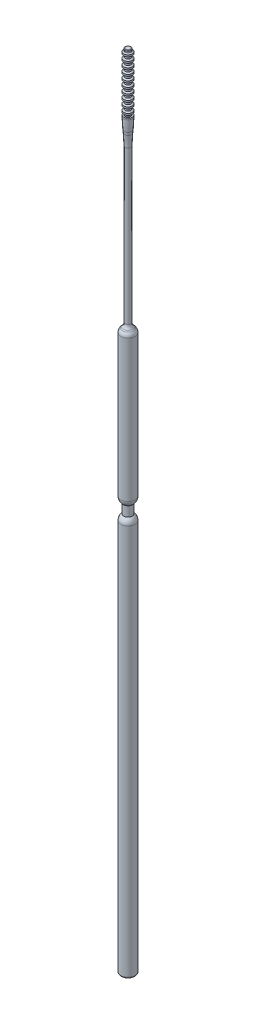
from build123d import *

# Parameters (mm, degrees)
SKETCH2_R           = 0.5
BOSS_EXTRUDE1_DEPTH = 5
FILLET1_R           = 20
BOSS_EXTRUDE3_DEPTH = 1
MOVE_FACE1_BY       = 0.25
BOSS_EXTRUDE4_START = 21.5
SKETCH8_R           = 0.5
BOSS_EXTRUDE4_DEPTH = 21.5
FILLET6_R           = 0.25
FILLET7_R           = 1
LPATTERN1_COUNT     = 10
LPATTERN1_PITCH     = 1
FILLET8_R           = 0.1


with BuildPart() as part:
    # Sketch2 → Boss-Extrude1 (new body)
    with BuildSketch(Plane(origin=(0, 0, 0), x_dir=(1, 0, 0), z_dir=(0, 1, 0))):
        with Locations(Location((0, 0, 0), (0, 0, 270))):
            Circle(SKETCH2_R)
    extrude(amount=BOSS_EXTRUDE1_DEPTH)

    # Sketch4 → Revolve1 (revolve)
    with BuildSketch(Plane(origin=(0, 0, 0), x_dir=(0, 0, -1), z_dir=(1, 0, 0))):
        Polygon((0, 5.000000000000001), (0, 10.500000000000002), (0.75, 10.500000000000002), (0.7500000000000002, 9.000000000000002), (0.5, 6.500000000000001), (0.5, 5.000000000000001), align=None)
    revolve(axis=Axis((0, 5.000000000000001, 0), (0, 1, 0)))

    # Fillet1
    # the kernel refuses this fillet: 20 mm, written as the material it adds along each edge
    with BuildSketch(Plane(origin=(0, 6.500000000000001, 0), x_dir=(0, 0, -1), z_dir=(1, 0, 0))) as fillet1_piece_1:
        with BuildLine():
            CenterArc((0.5 + FILLET1_R, -FILLET1_R * 0.0498756211209), FILLET1_R, 174.28940686250036, 5.710593137499643)
            Line((0.5 + FILLET1_R * 0.00496280979001, FILLET1_R * 0.0496280979001), (0.5, 0))
            Line((0.5, 0), (0.5, -FILLET1_R * 0.0498756211209))
        make_face()
    revolve(axis=Axis((0, 6.500000000000001, 0), (0, 1, 0)))
    # the kernel refuses this fillet: 20 mm, written as the material it takes off along each edge
    with BuildSketch(Plane(origin=(0, 9.000000000000002, 0), x_dir=(0, 0, -1), z_dir=(1, 0, 0))) as fillet1_2_piece_1:
        with BuildLine():
            CenterArc((0.7500000000000002 - FILLET1_R, FILLET1_R * 0.0498756211209), FILLET1_R, 354.28940686250036, 5.710593137499647)
            Line((0.75, FILLET1_R * 0.0498756211209), (0.7500000000000002, 0))
            Line((0.7500000000000002, 0), (0.7500000000000002 - FILLET1_R * 0.00496280979001, -FILLET1_R * 0.0496280979001))
        make_face()
    revolve(axis=Axis((0, 9.000000000000002, 0), (0, 1, 0)), mode=Mode.SUBTRACT)

    # Sketch5 → Boss-Extrude3 (add)
    with BuildSketch(Plane(origin=(0, 10.500000000000002, 0), x_dir=(1, 0, 0), z_dir=(0, 1, 0))):
        with BuildLine():
            ThreePointArc((0.12499999999999366, 0.48412291827592874), (-1.329e-14, 0.5), (-0.1250000000000195, 0.4841229182759221))
            Line((-0.12500000000000006, 0.48412291827591764), (-0.12500000000000003, 0.125))
            Line((-0.125, 0.125), (0.125, 0.125))
            Line((0.12499999999999999, 0.125), (0.12499999999999994, 0.4841229182759302))
        make_face()
        with BuildLine():
            Line((0.48412291827592446, 0.125), (0.125, 0.125))
            Line((0.12499999999999999, 0.125), (0.12500000000000003, -0.125))
            Line((0.125, -0.125), (0.48412291827592446, -0.125))
            ThreePointArc((0.48412291827592574, -0.12500000000000536), (0.49601484813358304, -0.06300214624136663), (0.5, -1.2e-16))
            ThreePointArc((0.5, 0), (0.496014848133583, 0.06300214624136691), (0.4841229182759257, 0.12500000000000558))
        make_face()
        with BuildLine():
            ThreePointArc((0.4841229182759257, 0.12500000000000558), (0.3535533905932694, 0.35355339059327817), (0.12499999999999366, 0.48412291827592874))
            Line((0.12499999999999994, 0.4841229182759302), (0.12499999999999999, 0.125))
            Line((0.125, 0.125), (0.48412291827592446, 0.125))
        make_face()
        with BuildLine():
            Line((0.48412291827592446, -0.125), (0.125, -0.125))
            Line((0.12500000000000003, -0.125), (0.12500000000000006, -0.48412291827593024))
            ThreePointArc((0.12499999999999353, -0.4841229182759288), (0.3535533905932696, -0.3535533905932779), (0.48412291827592574, -0.12500000000000536))
        make_face()
        with BuildLine():
            Line((0.125, -0.125), (-0.125, -0.125))
            Line((-0.12499999999999999, -0.125), (-0.12499999999999994, -0.4841229182759178))
            ThreePointArc((-0.1250000000000195, -0.4841229182759221), (-1.341e-14, -0.5), (0.12499999999999353, -0.4841229182759288))
            Line((0.12500000000000006, -0.48412291827593024), (0.12500000000000003, -0.125))
        make_face()
        Polygon((0.125, 0.125), (-0.125, 0.125), (-0.12499999999999999, -0.125), (0.125, -0.125), align=None)
        with BuildLine():
            Line((-0.12499999999999999, -0.125), (-0.12500000000000003, 0.125))
            Line((-0.125, 0.125), (-0.48412291827591875, 0.125))
            ThreePointArc((-0.48412291827592263, 0.12500000000001735), (-0.5, 6e-17), (-0.4841229182759227, -0.1250000000000172))
            Line((-0.48412291827591875, -0.125), (-0.125, -0.125))
        make_face()
        with BuildLine():
            Line((-0.12500000000000003, 0.125), (-0.12500000000000006, 0.48412291827591764))
            ThreePointArc((-0.1250000000000195, 0.4841229182759221), (-0.3535533905932745, 0.353553390593273), (-0.48412291827592263, 0.12500000000001735))
            Line((-0.48412291827591875, 0.125), (-0.125, 0.125))
        make_face()
        with BuildLine():
            Line((-0.12499999999999994, -0.4841229182759178), (-0.12499999999999999, -0.125))
            Line((-0.125, -0.125), (-0.48412291827591875, -0.125))
            ThreePointArc((-0.4841229182759227, -0.1250000000000172), (-0.3535533905932746, -0.3535533905932729), (-0.1250000000000195, -0.4841229182759221))
        make_face()
    boss_extrude3 = extrude(amount=BOSS_EXTRUDE3_DEPTH)

    # Sketch10 → Revolve5 (revolve)
    with BuildSketch(Plane.XY):
        Polygon((0, 11.500000000000004), (0.7500000000000002, 10.974844346342728), (0.75, 10.669650699152365), (5e-17, 11.19480635280964), align=None)
    revolve5 = revolve(axis=Axis((0, 11.500000000000004, 0), (1.8e-16, -1, 0)))

    # Move Face1: a face moved inward by 0.25
    extrude(part.faces().sort_by_distance((0.6, 10.5, 0))[0], amount=MOVE_FACE1_BY, dir=(0, -1, 0), mode=Mode.SUBTRACT)

    # Sketch8 → Boss-Extrude4 (add)
    with BuildSketch(Plane(origin=(0, 0, 0), x_dir=(-1, 0, 0), z_dir=(0, -1, 0)).offset(BOSS_EXTRUDE4_START)):
        with Locations(Location((0, 0, 0), (0, 0, 180))):
            Circle(SKETCH8_R)
    extrude(amount=-BOSS_EXTRUDE4_DEPTH)

    # Sketch9 → Revolve4 (revolve)
    with BuildSketch(Plane.XY, mode=Mode.PRIVATE) as revolve4_sk:
        with BuildLine():
            Line((0, -21.5), (-0.5, -21.5))
            Line((-0.5, -21.5), (-0.4999999999999998, -22))
            Line((-0.4999999999999998, -22), (-1.2499999999999998, -22.75))
            Line((-1.2499999999999998, -22.75), (-1.2499999999999998, -23.25))
            Line((-1.2499999999999998, -23.25), (-1.2499999999999967, -48.25))
            ThreePointArc((-1.249999999999998, -48.25), (-1.1180339887498931, -48.80901699437494), (-0.7499999999999993, -49.24999999999999))
            Line((-0.7499999999999999, -49.24999999999999), (-0.7499999999999997, -51.00000000000001))
            ThreePointArc((-0.7499999999999996, -51.00000000000001), (-1.1180339887498953, -51.44098300562506), (-1.2499999999999964, -52.00000000000001))
            Line((-1.2499999999999964, -52.00000000000001), (-1.2499999999999876, -120.25))
            Line((-1.2499999999999876, -120.25000000000001), (-1.2499999999999878, -121.50000000000001))
            Line((-1.2499999999999878, -121.50000000000001), (0, -121.50000000000001))
            Line((0, -121.5), (0, -52.00000000000001))
            Line((4.6e-16, -52.00000000000001), (0, -48.25))
            Line((0, -48.25), (0, -21.5))
        make_face()
    revolve(revolve4_sk.sketch.rotate(Axis((0, -21.5, 0), (0, -1, 0)), 270), axis=Axis((0, -21.5, 0), (0, -1, 0)))

    # Fillet6
    fillet6_edges = [part.edges().sort_by_distance(p)[0] for p in [
        (-4.3e-16, -121.50000000000001, -1.2499999999999878),
    ]]
    fillet(fillet6_edges, radius=FILLET6_R)

    # Fillet7
    fillet7_edges = [part.edges().sort_by_distance(p)[0] for p in [
        (-1.7e-16, -22, -0.4999999999999998),
        (-4.3e-16, -22.75, -1.2499999999999998),
    ]]
    fillet(fillet7_edges, radius=FILLET7_R)

    # LPattern1: Boss-Extrude3, Revolve5 ×10
    with Locations(*[(0, i * LPATTERN1_PITCH, 0) for i in range(1, LPATTERN1_COUNT)]):
        add(boss_extrude3)
        add(revolve5)

    # Fillet8
    fillet8_edges = [part.edges().sort_by_distance(p)[0] for p in [
        (0.3061862178478884, 20.149896230895155, -0.39528470752105255),
        (0.125000000000012, 20.5, 0.48412291827592546),
    ]]
    fillet(fillet8_edges, radius=FILLET8_R)


solid = part.part
